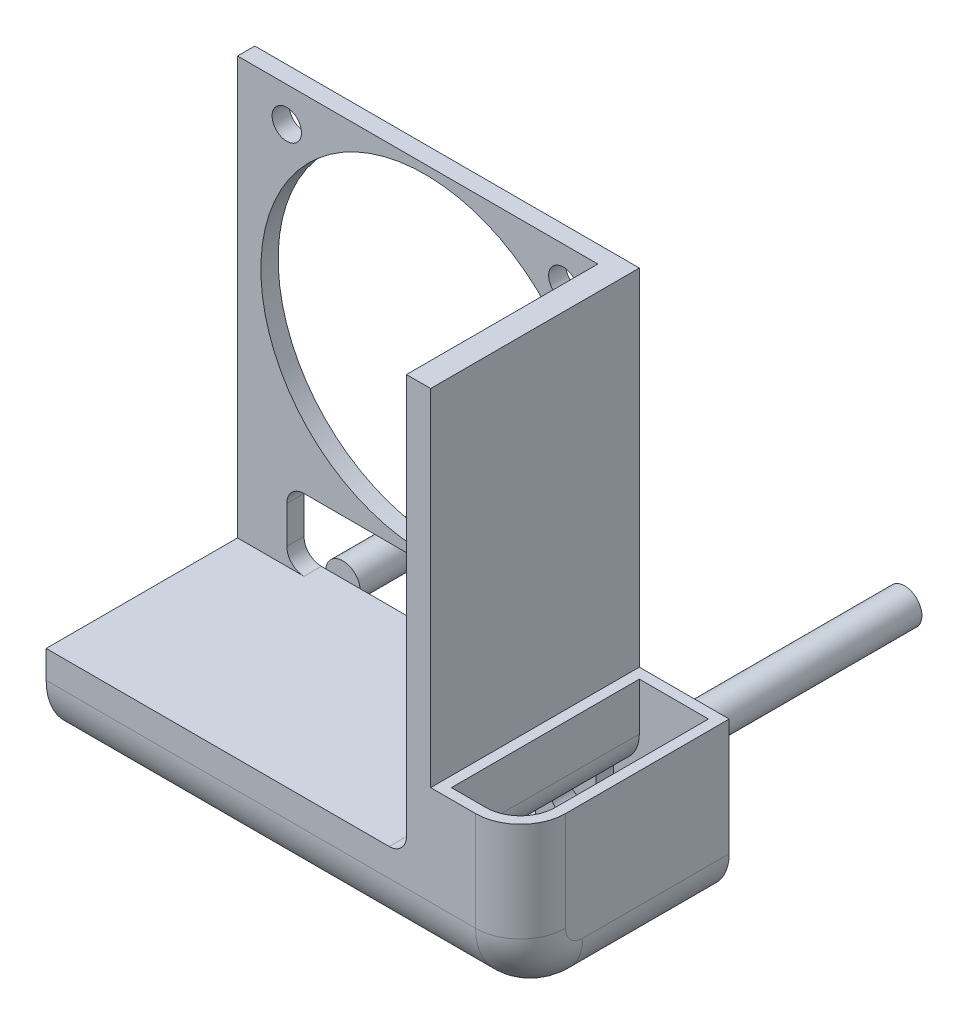
from build123d import *

# Parameters (mm, degrees)
SKETCH1_W                           = 40
SKETCH1_H                           = 40
BOSS_EXTRUDE1_DEPTH                 = 2
M3_CLEARANCE_HOLE1_D                = 3.4
SKETCH10_W                          = 40
SKETCH10_H                          = 8.3
BOSS_EXTRUDE7_DEPTH                 = 2
BOSS_EXTRUDE10_START                = 6
SKETCH20_R                          = 2
BOSS_EXTRUDE10_DEPTH                = 30
BOSS_EXTRUDE10_2_DEPTH              = 30
BOSS_EXTRUDE11_DEPTH                = 21.75
FILLET4_R                           = 6
FILLET1_R                           = 4
SHELL1_T                            = 1.2
SKETCH25_W                          = 2.8
SKETCH25_H                          = 48.3
BOSS_EXTRUDE14_DEPTH                = 24.15
SKETCH26_W                          = 36
SKETCH26_H                          = 8.3
CUT_EXTRUDE5_DEPTH                  = 77.64359073
SKETCH27_R                          = 19
CUT_EXTRUDE6_DEPTH                  = 77.64359073
FILLET2_R                           = 2
FILLET3_R                           = 2
SKETCH29_W                          = 1.7
SKETCH29_H                          = 48.3
BOSS_EXTRUDE15_DEPTH                = 2
DELETEFACE1_OUTLINE_R               = 1.7
DELETEFACE1_DEPTH                   = 2
SKETCH32_W                          = 7
SKETCH32_H                          = 8
BOSS_EXTRUDE16_DEPTH                = 2
SKETCH31_W                          = 1.75
SKETCH31_H                          = 3.201
F_3_5_3_5_DIAMETER_HOLE1_AT_2_COUNT = 2
F_3_5_3_5_DIAMETER_HOLE1_AT_2_PITCH = 35


# Read off the part's stored shape, not the designer's step: DeleteFace1
with BuildPart() as part:
    # Sketch1 → Boss-Extrude1 (new body)
    with BuildSketch(Plane.XY):
        with Locations((20, 20)):
            Rectangle(SKETCH1_W, SKETCH1_H)
    extrude(amount=BOSS_EXTRUDE1_DEPTH)

    # M3 Clearance Hole1 (through all)
    with Locations(Plane.XY.offset(2)):
        with Locations((4, 36), (36, 4), (4, 4), (36, 36)):
            Hole(M3_CLEARANCE_HOLE1_D / 2)

    # Sketch10 → Boss-Extrude7 (add)
    with BuildSketch(Plane.XY.offset(2)):
        with Locations((20, -4.15)):
            Rectangle(SKETCH10_W, SKETCH10_H)
    extrude(amount=-BOSS_EXTRUDE7_DEPTH)



with BuildPart() as body_2:
    # Sketch20 → Boss-Extrude10 (new body)
    with BuildSketch(Plane(origin=(0, 0, 0), x_dir=(-1, 0, 0), z_dir=(0, 0, -1)).offset(BOSS_EXTRUDE10_START)):
        with Locations((-37.5, -14.5)):
            Circle(SKETCH20_R)
    extrude(amount=BOSS_EXTRUDE10_DEPTH)


with BuildPart() as body_3:
    # Sketch20 → Boss-Extrude10 2 (new body)
    with BuildSketch(Plane(origin=(0, 0, 0), x_dir=(-1, 0, 0), z_dir=(0, 0, -1)).offset(BOSS_EXTRUDE10_START)):
        with Locations((-2.5, -14.5)):
            Circle(SKETCH20_R)
    extrude(amount=BOSS_EXTRUDE10_2_DEPTH)


with BuildPart() as body_4:
    # Sketch22 → Boss-Extrude11 (new body)
    with BuildSketch(Plane(origin=(0, 0, 22.95), x_dir=(-1, 0, 0), z_dir=(0, 0, -1))):
        Polygon((-44, 0), (-52, 0), (-52, -17.5), (0.5, -17.5), (0.5, -9.5), (-44, -9.5), align=None)
    extrude(amount=BOSS_EXTRUDE11_DEPTH)

    # Fillet4
    fillet4_edges = [body_4.edges().sort_by_distance(p)[0] for p in [
        (25.75, -17.5, 22.95),
    ]]
    fillet(fillet4_edges, radius=FILLET4_R)

    # Fillet1
    fillet1_edges = [body_4.edges().sort_by_distance(p)[0] for p in [
        (44, -9.5, 12.075),
        (52, -17.5, 9.075),
        (52, -15.742640687, 21.192640687),
        (52, -5.75, 22.95),
    ]]
    fillet(fillet1_edges, radius=FILLET1_R)

    # Shell1
    shell1_openings = [body_4.faces().sort_by_distance(p)[0] for p in [
        (47.937463249, 0, 11.874064326),
    ]]
    offset(amount=SHELL1_T, openings=shell1_openings, kind=Kind.INTERSECTION)


with BuildPart() as part_1:
    add(part.part)

    add(body_4.part)  # Boss-Extrude14 merges body 4
    # Sketch25 → Boss-Extrude14 (add)
    with BuildSketch(Plane(origin=(0, 0, 0), x_dir=(-1, 0, 0), z_dir=(0, 0, -1))):
        with Locations((-41.4, 15.85)):
            Rectangle(SKETCH25_W, SKETCH25_H)
    extrude(amount=-BOSS_EXTRUDE14_DEPTH)

    # Sketch26 → Cut-Extrude5 (cut, through all)
    with BuildSketch(Plane.XY.offset(2)):
        with Locations((22, -4.15)):
            Rectangle(SKETCH26_W, SKETCH26_H)
    extrude(amount=-CUT_EXTRUDE5_DEPTH, mode=Mode.SUBTRACT)

    # Sketch27 → Cut-Extrude6 (cut, through all)
    with BuildSketch(Plane.XY.offset(2)):
        with Locations((20, 20)):
            Circle(SKETCH27_R)
    extrude(amount=-CUT_EXTRUDE6_DEPTH, mode=Mode.SUBTRACT)

    # Fillet2
    fillet2_edges = [part_1.edges().sort_by_distance(p)[0] for p in [
        (4, 0, 1),
        (40, 0, 1),
        (4, -8.3, 1),
    ]]
    fillet(fillet2_edges, radius=FILLET2_R)

    # Fillet3
    fillet3_edges = [part_1.edges().sort_by_distance(p)[0] for p in [
        (40, -8.3, 12.075),
    ]]
    fillet(fillet3_edges, radius=FILLET3_R)

    # Sketch29 → Boss-Extrude15 (add)
    with BuildSketch(Plane.XY.offset(2)):
        with Locations((-0.85, 15.85)):
            Rectangle(SKETCH29_W, SKETCH29_H)
    extrude(amount=-BOSS_EXTRUDE15_DEPTH)

    # DeleteFace1 outline → DeleteFace1 (add)
    with BuildSketch(Plane.XY):
        with Locations((4, 4)):
            Circle(DELETEFACE1_OUTLINE_R)
    extrude(amount=DELETEFACE1_DEPTH)

    # Sketch32 → Boss-Extrude16 (add)
    with BuildSketch(Plane.XY.offset(1.2)):
        with Locations((2.5, -13.5)):
            Rectangle(SKETCH32_W, SKETCH32_H)
        with Locations((37.5, -13.5)):
            Rectangle(SKETCH32_W, SKETCH32_H)
    extrude(amount=BOSS_EXTRUDE16_DEPTH)

    # Sketch31 → Ø3.5 (3.5) Diameter Hole1 (revolve, cut)
    with BuildSketch(Plane(origin=(37.5, -14.5, 0), x_dir=(0, 1, 0), z_dir=(1, 0, 0))):
        with Locations((0.875, 1.6005)):
            Rectangle(SKETCH31_W, SKETCH31_H)
    f_3_5_3_5_diameter_hole1 = revolve(axis=Axis((37.5, -14.5, -6.35), (0, 0, 1)), mode=Mode.SUBTRACT)

    # Ø3.5 (3.5) Diameter Hole1 at 2: Ø3.5 (3.5) Diameter Hole1 ×2
    with Locations(*[(-i * F_3_5_3_5_DIAMETER_HOLE1_AT_2_PITCH, 0, 0) for i in range(1, F_3_5_3_5_DIAMETER_HOLE1_AT_2_COUNT)]):
        add(f_3_5_3_5_diameter_hole1, mode=Mode.SUBTRACT)


solid = Compound([body_2.part, body_3.part, part_1.part])
